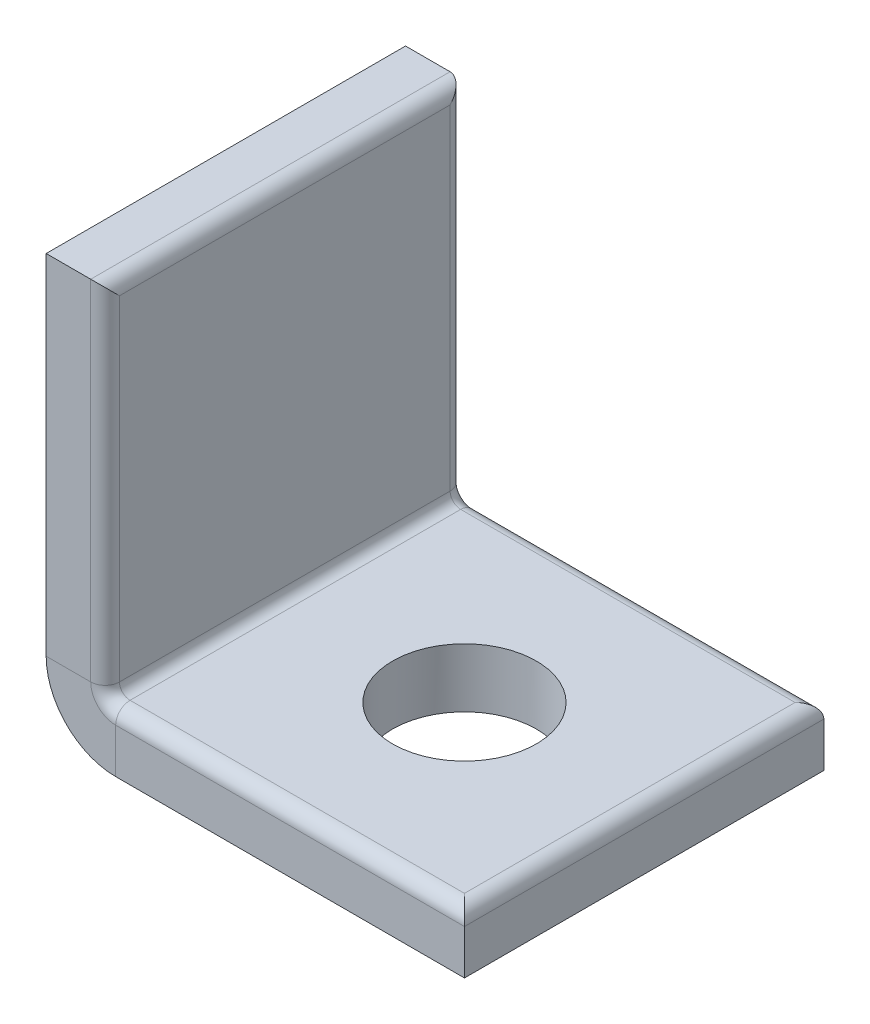
from build123d import *

# Parameters (mm, degrees)
BASE_FLANGE1_DEPTH = 25
FILLET1_R          = 1
SKETCH6_R          = 5
CUT_EXTRUDE1_DEPTH = 10


# Sheet-metal steps are written as plain solids
with BuildPart() as part:
    # Sketch1 → Base-Flange1 (new body)
    with BuildSketch(Plane.XY):
        with BuildLine():
            Line((25, 0), (0.7366, 0))
            ThreePointArc((0.7366, 0), (0.215745145, 0.215745145), (0, 0.7366))
            Line((0, 0.7366), (0, 25))
            Line((0, 25), (-4.1, 25))
            Line((-4.1, 25), (-4.1, 0.7366))
            ThreePointArc((-4.1, 0.7366), (-2.683392658, -2.683392658), (0.7366, -4.1))
            Line((0.7366, -4.1), (25, -4.1))
            Line((25, -4.1), (25, 0))
        make_face()
    extrude(amount=-BASE_FLANGE1_DEPTH)

    # Fillet1
    fillet1_edges = [part.edges().sort_by_distance(p)[0] for p in [
        (0, 25, -12.5),
        (12.8683, 0, -25),
        (25, 0, -12.5),
        (0.215745145, 0.215745145, -25),
        (0, 12.8683, -25),
        (0, 12.8683, 0),
        (0.215745145, 0.215745145, 0),
        (12.8683, 0, 0),
    ]]
    fillet(fillet1_edges, radius=FILLET1_R)

    # Sketch6 → Cut-Extrude1 (cut)
    with BuildSketch(Plane(origin=(0, 0, 0), x_dir=(1, 0, 0), z_dir=(0, 1, 0))):
        with Locations(Location((12.5, 12.5, 0), (0, 0, 270))):
            Circle(SKETCH6_R)
    extrude(amount=-CUT_EXTRUDE1_DEPTH, mode=Mode.SUBTRACT)


solid = part.part
